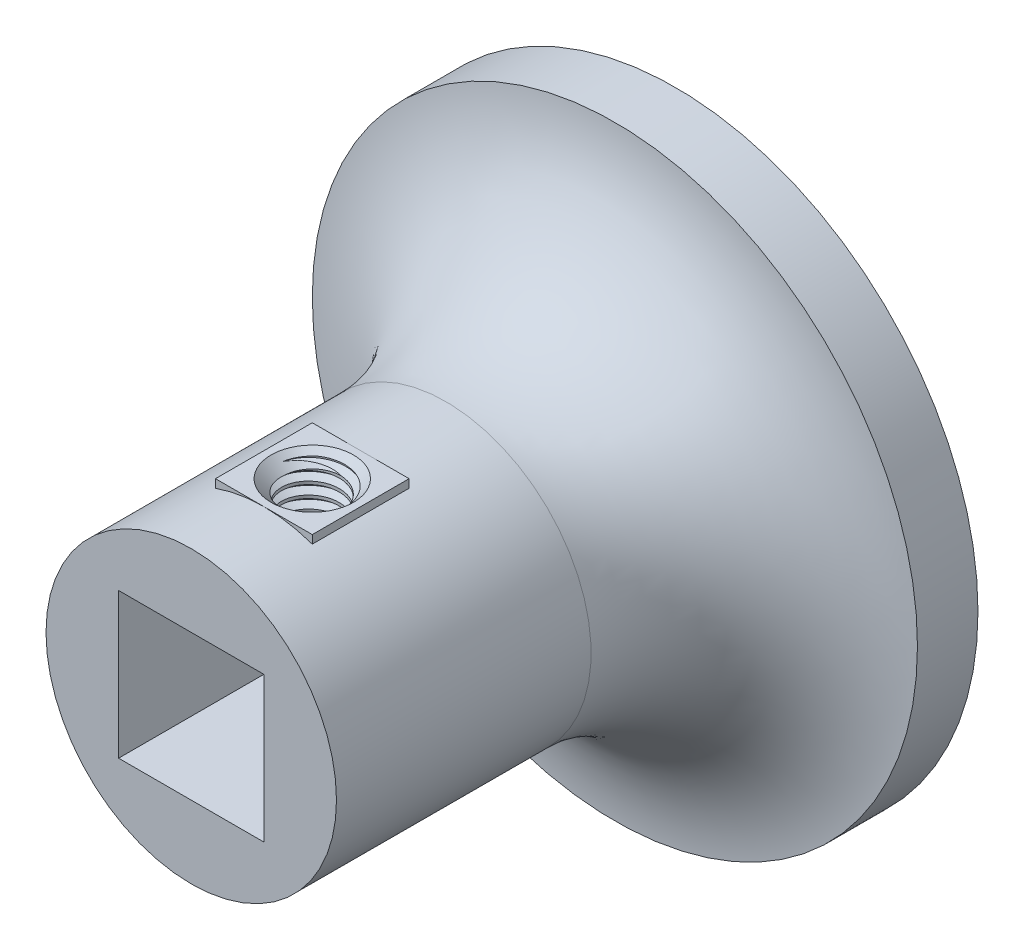
from build123d import *

# Parameters (mm, degrees)
SKETCH1_R           = 12.5
BOSS_EXTRUDE1_DEPTH = 3
SKETCH4_R           = 3.505
CUT_EXTRUDE1_DEPTH  = 2.5
SKETCH5_R           = 6
BOSS_EXTRUDE2_DEPTH = 17.5
SKETCH6_R           = 2.005
CUT_EXTRUDE2_DEPTH  = 1.5
CUT_EXTRUDE3_DEPTH  = 8
FILLET1_R           = 7
SKETCH8_W           = 6
SKETCH8_H           = 6
CUT_EXTRUDE4_DEPTH  = 8.5
BOSS_EXTRUDE3_REACH = 32.311
SKETCH23_W          = 4
SKETCH23_H          = 4
SKETCH24_R          = 1.2
CUT_EXTRUDE6_DEPTH  = 7
CHAMFER3_SIZE       = 0.5
THREAD3_PITCH       = 0.5
SKETCH25_R          = 12.774997479
SKETCH25_R_2        = 3.505
CUT_EXTRUDE9_DEPTH  = 0.5


with BuildPart() as part:
    # Sketch1 → Boss-Extrude1 (new body)
    with BuildSketch(Plane.XY):
        Circle(SKETCH1_R)
    extrude(amount=BOSS_EXTRUDE1_DEPTH)

    # Sketch4 → Cut-Extrude1 (cut)
    with BuildSketch(Plane(origin=(0, 0, 0), x_dir=(-1, 0, 0), z_dir=(0, 0, -1))):
        Circle(SKETCH4_R)
    extrude(amount=-CUT_EXTRUDE1_DEPTH, mode=Mode.SUBTRACT)

    # Sketch5 → Boss-Extrude2 (add)
    with BuildSketch(Plane.XY.offset(3)):
        Circle(SKETCH5_R)
    extrude(amount=BOSS_EXTRUDE2_DEPTH)

    # Sketch6 → Cut-Extrude2 (cut)
    with BuildSketch(Plane(origin=(0, 0, 2.5), x_dir=(-1, 0, 0), z_dir=(0, 0, -1))):
        Circle(SKETCH6_R)
    extrude(amount=-CUT_EXTRUDE2_DEPTH, mode=Mode.SUBTRACT)

    # Sketch7 → Cut-Extrude3 (cut)
    with BuildSketch(Plane(origin=(0, 0, 4), x_dir=(-1, 0, 0), z_dir=(0, 0, -1))):
        with BuildLine():
            Line((-1.32476413, 1.505), (1.32476413, 1.505))
            ThreePointArc((1.32476413, 1.505), (0, -2.005), (-1.32476413, 1.505))
        make_face()
    extrude(amount=-CUT_EXTRUDE3_DEPTH, mode=Mode.SUBTRACT)

    # Fillet1
    # the kernel refuses this fillet: 7 mm, written as the material it adds along each edge
    with BuildSketch(Plane(origin=(0, 0, 3), x_dir=(1, 0, 0), z_dir=(0, -1, 0))) as fillet1_piece_1:
        with BuildLine():
            CenterArc((13, 6.982120022), FILLET1_R, 180, 85.903956242)
            Line((6, 6.982120022), (5.86, 6.982120022))
            Line((5.86, 6.982120022), (5.86, 0))
            Line((5.86, 0), (6, -0.14))
            ThreePointArc((6, -0.14), (9.25, -0.14), (12.49, -0.1396424))
            Line((12.49, -0.1396424), (12.5, 0))
        make_face()
    revolve(axis=Axis((0, 0, 3), (0, 0, 1)))

    # Sketch8 → Cut-Extrude4 (cut)
    with BuildSketch(Plane.XY.offset(20.5)):
        Rectangle(SKETCH8_W, SKETCH8_H)
    extrude(amount=-CUT_EXTRUDE4_DEPTH, mode=Mode.SUBTRACT)

    # Sketch23 → Boss-Extrude3 (add, up to next)
    with BuildSketch(Plane(origin=(0, 6, 0), x_dir=(1, 0, 0), z_dir=(0, 1, 0)), mode=Mode.PRIVATE) as boss_extrude3_sk1:
        with Locations((0, -15.5)):
            Rectangle(SKETCH23_W, SKETCH23_H)
    boss_extrude3_tool1 = extrude(boss_extrude3_sk1.sketch, amount=-BOSS_EXTRUDE3_REACH, mode=Mode.PRIVATE) - part.part
    add(boss_extrude3_tool1.solids().sort_by_distance((0, 6, 15.5))[0])
    add(boss_extrude3_tool1.solids().sort_by_distance((0, 6, 15.5))[1])

    # Sketch24 → Cut-Extrude6 (cut)
    with BuildSketch(Plane(origin=(0, 6, 0), x_dir=(1, 0, 0), z_dir=(0, 1, 0))):
        with Locations(Location((0, -15.5, 0), (0, 0, 270))):
            Circle(SKETCH24_R)
    extrude(amount=-CUT_EXTRUDE6_DEPTH, mode=Mode.SUBTRACT)

    # Chamfer3
    chamfer3_edges = [part.edges().sort_by_distance(p)[0] for p in [
        (0, 6, 14.3),
    ]]
    chamfer(chamfer3_edges, length=CHAMFER3_SIZE)

    # Thread3: the profile of Thread Profile3 profile screwed along a right-hand helix of 10 turns, 6 arcs to a turn; built about Z, then put on its axis
    thread3_z = Axis((0, 0, 0), (0, 0, 1))
    thread3_corners = [(1.1997, 0, -0.000173205), (1.470632938, 0, 0.156249999), (1.470632938, 0, 0.218749999), (1.1997, 0, 0.375173204)]
    with BuildLine(mode=Mode.PRIVATE) as thread3_profile:
        Line(thread3_corners[0], thread3_corners[1])
        Line(thread3_corners[1], thread3_corners[2])
        Line(thread3_corners[2], thread3_corners[3])
        Line(thread3_corners[3], thread3_corners[0])
    thread3_cap = Face(thread3_profile.wire())
    thread3_turn_angles = [0, 30, 60, 90, 120, 150, 180, 210, 240, 270, 300, 330, 360]
    thread3_turn_weights = [1, 0.8660254037844387, 1, 0.8660254037844387, 1, 0.8660254037844387, 1, 0.8660254037844387, 1, 0.8660254037844387, 1, 0.8660254037844387, 1]
    thread3_turn_rails = [Edge.make_bspline([Vector(p[0], p[1], 0).rotate(thread3_z, thread3_turn_angles[k]) / thread3_turn_weights[k] + Vector(0, 0, p[2] + THREAD3_PITCH * thread3_turn_angles[k] / 360) for k in range(13)], [0, 0, 0, 1, 1, 2, 2, 3, 3, 4, 4, 5, 5, 6, 6, 6], 2, thread3_turn_weights) for p in thread3_corners]
    thread3_turn_sides = [Face.make_surface_from_curves(thread3_turn_rails[p[0]], thread3_turn_rails[p[1]]) for p in [(0, 1), (1, 2), (2, 3), (3, 0)]]
    thread3 = Plane(origin=(0, 6.5, 15.5), x_dir=(-1, 0, 0), z_dir=(0, -1, 0)) * Solid(Shell([*[p.moved(Location((0, 0, THREAD3_PITCH * i))) for i in range(10) for p in thread3_turn_sides], thread3_cap, thread3_cap.rotate(thread3_z, 3600).moved(Location((0, 0, THREAD3_PITCH * 3600 / 360)))]))
    add(thread3, mode=Mode.SUBTRACT)

    # Sketch25 → Cut-Extrude9 (cut)
    with BuildSketch(Plane(origin=(0, 0, 0), x_dir=(-1, 0, 0), z_dir=(0, 0, -1))):
        Circle(SKETCH25_R)
        Circle(SKETCH25_R_2, mode=Mode.SUBTRACT)
    extrude(amount=-CUT_EXTRUDE9_DEPTH, mode=Mode.SUBTRACT)


solid = part.part
